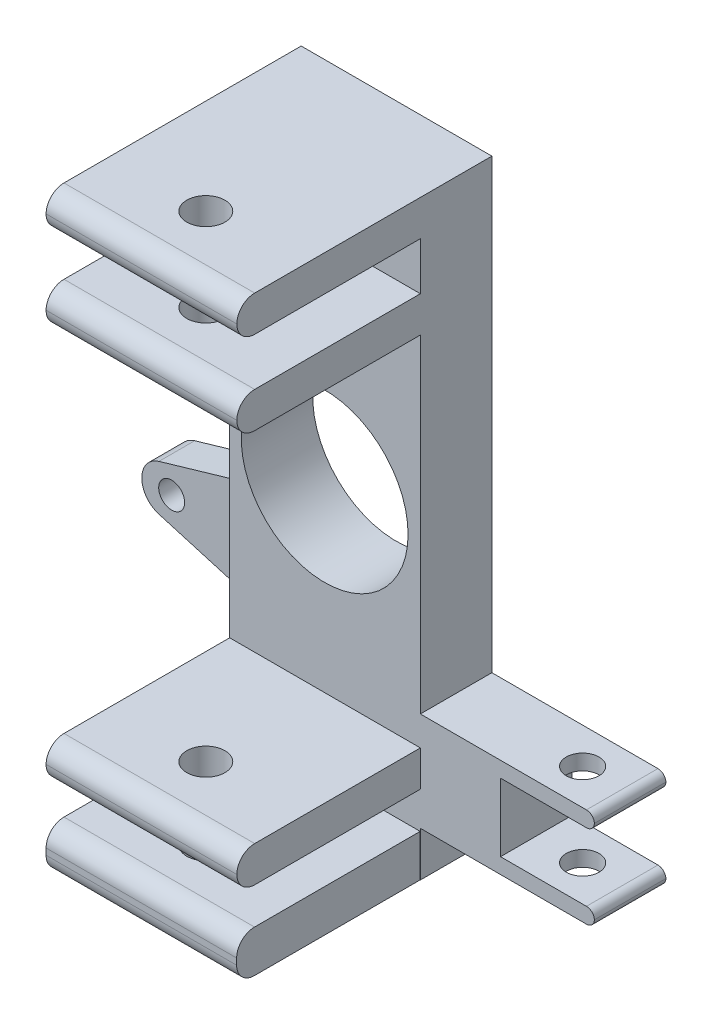
from build123d import *

# Parameters (mm, degrees)
SKETCH2_W               = 80
SKETCH2_H               = 248
BOSS_EXTRUDE1_DEPTH     = 30
BOSS_EXTRUDE2_DEPTH     = 15
SKETCH3_W               = 80
SKETCH3_H               = 15
SKETCH3_W_2             = 79.927982428
SKETCH3_H_2             = 17.63
BOSS_EXTRUDE3_DEPTH     = 107
FILLET1_R               = 7.5
FILLET2_R               = 3.33
CUT_EXTRUDE1_DEPTH      = 311.421758238
CUT_EXTRUDE1_DEPTH_BACK = 311.421758238
SKETCH4_R               = 35
CUT_EXTRUDE2_DEPTH      = 311.421758238
CUT_EXTRUDE2_DEPTH_BACK = 311.421758238
SKETCH5_R               = 8
SKETCH6_R               = 6.855911781
CUT_EXTRUDE3_DEPTH      = 265.72901312
SKETCH7_R               = 5.441513082
CUT_EXTRUDE4_DEPTH      = 306.575961076
SKETCH8_R               = 4
CUT_EXTRUDE5_DEPTH      = 306.575961076


# Some blends are built 0.0001 mm under size
with BuildPart() as part:
    # Sketch2 → Boss-Extrude1 (new body)
    with BuildSketch(Plane.XY):
        with Locations((40, 124)):
            Rectangle(SKETCH2_W, SKETCH2_H)
        Polygon((153, 60.32), (80, 60.32), (80, 18.794599866), (153, 18.794599866), (153, 25.284599866), (113.63, 25.284599866), (113.63, 53.83), (153, 53.83), align=None)
    extrude(amount=BOSS_EXTRUDE1_DEPTH)

    # Sketch2<5> → Boss-Extrude2 (add)
    with BuildSketch(Plane.XY):
        with BuildLine():
            Line((0, 50), (0, 95.32))
            Line((0, 95.32), (-44.67244089, 82.258125951))
            ThreePointArc((-44.67244089, 82.258125951), (-51.866023561, 72.66), (-44.67244089, 63.061874049))
            Line((-44.67244089, 63.061874049), (0, 50))
        make_face()
        with BuildLine():
            Line((-10.531496207, 3.314319271), (0, 0.795400134))
            Line((0, 0.795400134), (0, 25.284599866))
            Line((0, 25.284599866), (-10.531496207, 22.765680729))
            ThreePointArc((-10.531496207, 22.765680729), (-18.205311701, 13.04), (-10.531496207, 3.314319271))
        make_face()
    extrude(amount=BOSS_EXTRUDE2_DEPTH)

    # Sketch3 → Boss-Extrude3 (add)
    with BuildSketch(Plane.XY):
        with Locations((40, 240.5)):
            Rectangle(SKETCH3_W, SKETCH3_H)
        with Locations((40, 205.5)):
            Rectangle(SKETCH3_W, SKETCH3_H)
        with Locations((40, 40.5)):
            Rectangle(SKETCH3_W, SKETCH3_H)
        with Locations((39.963991214, 8.815)):
            Rectangle(SKETCH3_W_2, SKETCH3_H_2)
    extrude(amount=BOSS_EXTRUDE3_DEPTH)

    # Fillet1
    fillet1_edges = [part.edges().sort_by_distance(p)[0] for p in [
        (39.963991214, 0, 107),
        (39.963991214, 17.63, 107),
        (40, 33, 107),
        (40, 48, 107),
        (40, 198, 107),
        (40, 213, 107),
        (40, 233, 107),
        (40, 248, 107),
    ]]
    fillet(fillet1_edges, radius=FILLET1_R - 0.0001)  # a hair under: the kernel refuses the full size

    # Fillet2
    # the kernel refuses this fillet: 3.33 mm, written as the material it takes off along each edge
    with BuildSketch(Plane(origin=(153, 18.794599866, -8.325), x_dir=(-1, 0, 0), z_dir=(0, 0, 1)), Plane(origin=(153, 25.284599866, -8.325), x_dir=(0, -1, 0), z_dir=(0, 0, 1)), Plane(origin=(153, 53.83, -8.325), x_dir=(-1, 0, 0), z_dir=(0, 0, 1)), Plane(origin=(153, 60.32, -8.325), x_dir=(0, -1, 0), z_dir=(0, 0, 1))) as fillet2_piece_1:
        with BuildLine():
            CenterArc((FILLET2_R, -FILLET2_R), FILLET2_R, 90, 90)
            Line((0, -FILLET2_R), (0, 0))
            Line((0, 0), (FILLET2_R, 0))
        make_face()
    extrude(amount=46.65, mode=Mode.SUBTRACT)

    # Sketch4 → Cut-Extrude1 (cut, two sides: drawn at the far end of the back side and taken through both)
    with BuildSketch(Plane.XY.offset(-CUT_EXTRUDE1_DEPTH_BACK)):
        with Locations((39.848575035, 123)):
            Circle(SKETCH4_R)
    extrude(amount=CUT_EXTRUDE1_DEPTH + CUT_EXTRUDE1_DEPTH_BACK, mode=Mode.SUBTRACT)

    # Sketch5 → Cut-Extrude2 (cut, two sides: drawn at the far end of the back side and taken through both)
    with BuildSketch(Plane(origin=(0, 0, 0), x_dir=(1, 0, 0), z_dir=(0, 1, 0)).offset(-CUT_EXTRUDE2_DEPTH_BACK)):
        with Locations(Location((40, -80, 0), (0, 0, 270))):
            Circle(SKETCH5_R)
    extrude(amount=CUT_EXTRUDE2_DEPTH + CUT_EXTRUDE2_DEPTH_BACK, mode=Mode.SUBTRACT)

    # Sketch6 → Cut-Extrude3 (cut, through all)
    with BuildSketch(Plane(origin=(0, 60.32, 0), x_dir=(1, 0, 0), z_dir=(0, 1, 0))):
        with Locations(Location((133.07, -15, 0), (0, 0, 270))):
            Circle(SKETCH6_R)
    extrude(amount=-CUT_EXTRUDE3_DEPTH, mode=Mode.SUBTRACT)

    # Sketch7 → Cut-Extrude4 (cut, through all)
    with BuildSketch(Plane.XY.offset(15)):
        with Locations((-39.33, 72.66)):
            Circle(SKETCH7_R)
    extrude(amount=-CUT_EXTRUDE4_DEPTH, mode=Mode.SUBTRACT)

    # Sketch8 → Cut-Extrude5 (cut, through all)
    with BuildSketch(Plane.XY.offset(15)):
        with Locations((-7.83, 13.04)):
            Circle(SKETCH8_R)
    extrude(amount=-CUT_EXTRUDE5_DEPTH, mode=Mode.SUBTRACT)


solid = part.part
